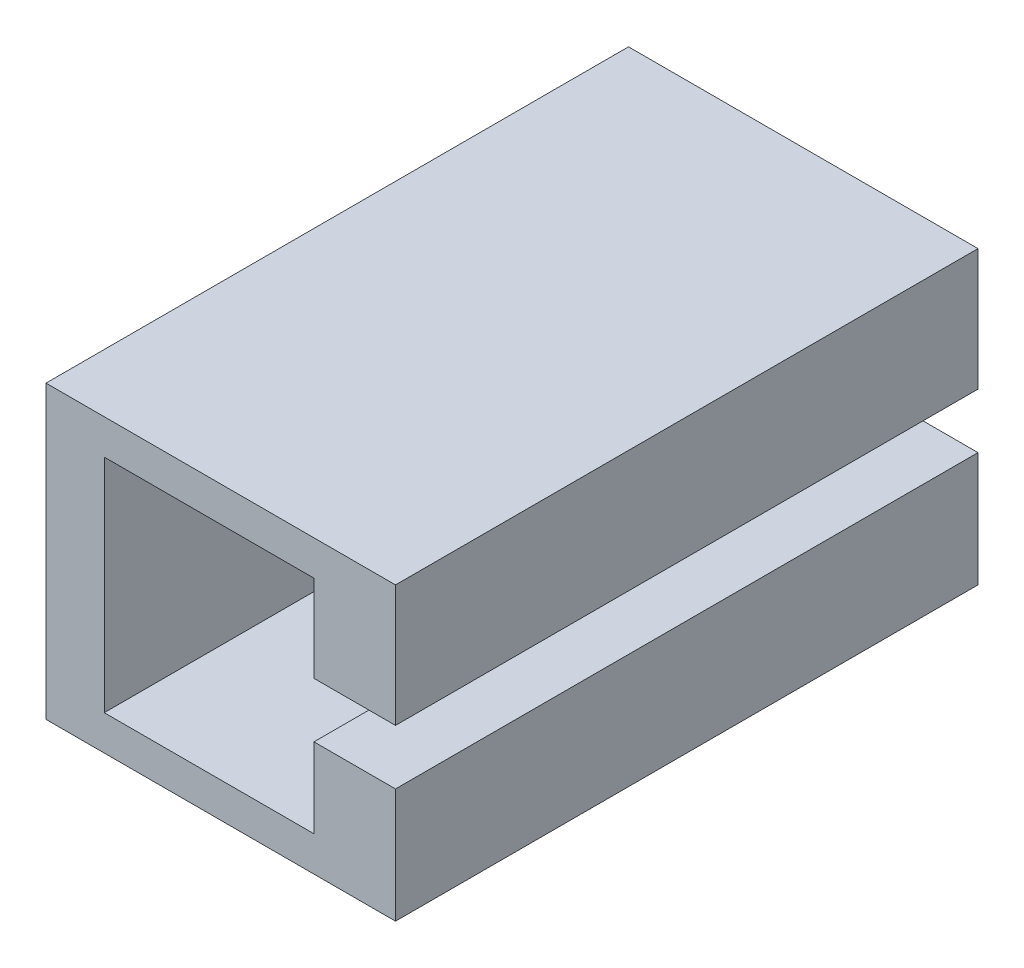
from build123d import *

# Parameters (mm, degrees)
BOSS_EXTRUDE1_DEPTH = 50
SKETCH3_R           = 0.55
CUT_EXTRUDE1_DEPTH  = 3


with BuildPart() as part:
    # Sketch1 → Boss-Extrude1 (new body)
    with BuildSketch(Plane.XY):
        Polygon((0, 0), (0, 25), (30, 25), (30, 14.553417219), (23, 14.553417219), (23, 22), (5, 22), (5, 3), (23, 3), (23, 9.833225485), (30, 9.833225485), (30, 0), align=None)
    extrude(amount=BOSS_EXTRUDE1_DEPTH)

    # Sketch3 → Cut-Extrude1 (cut)
    with BuildSketch(Plane.ZY):
        Polygon((4.919472148, 16.056705519), (21.919472148, 16.056705519), (21.919472148, 24.056705519), (27.919472148, 24.056705519), (27.919472148, 16.056705519), (42.919472148, 16.056705519), (42.919472148, 9.056705519), (27.919472148, 9.056705519), (27.919472148, 1.056705519), (21.919472148, 1.056705519), (21.919472148, 9.056705519), (4.919472148, 9.056705519), align=None)
        with Locations((40.25, 12.520312642)):
            Circle(SKETCH3_R, mode=Mode.SUBTRACT)
        with Locations((8.980224058, 12.520312642)):
            Circle(SKETCH3_R, mode=Mode.SUBTRACT)
    extrude(amount=-CUT_EXTRUDE1_DEPTH, mode=Mode.SUBTRACT)


solid = part.part
